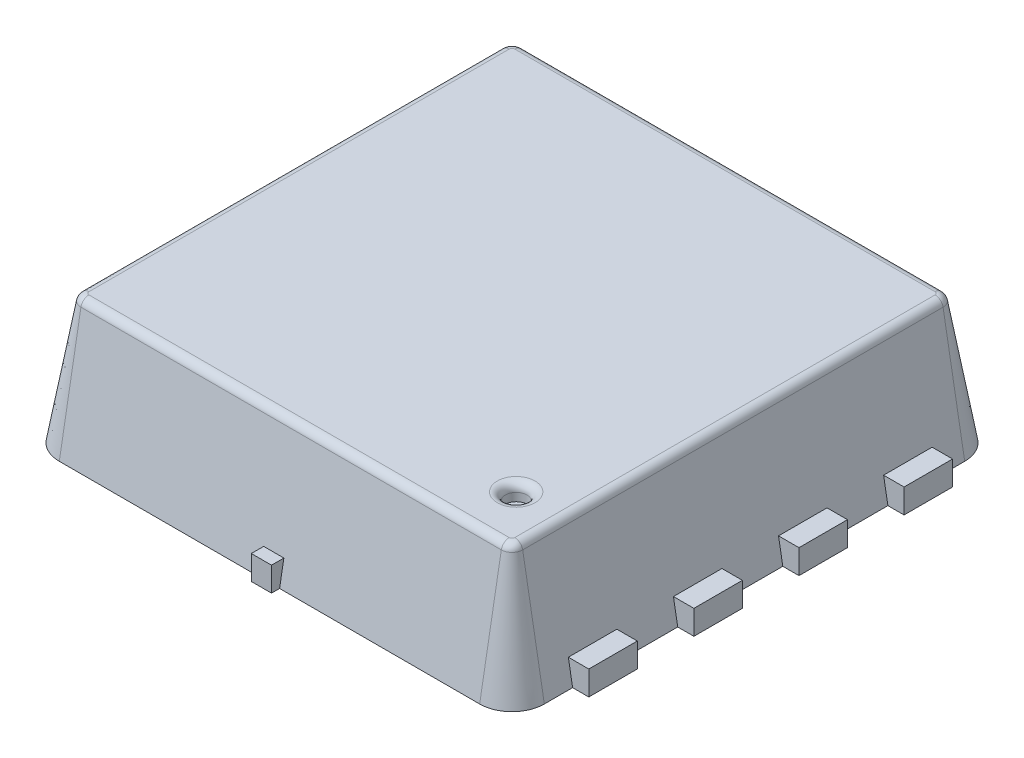
from build123d import *

# Parameters (mm, degrees)
SKETCH1_W               = 3
SKETCH1_H               = 3
BOSS_EXTRUDE1_DEPTH     = 0.8
FILLET1_R               = 0.2
CHAMFER1_SIZE           = 0.8
CHAMFER1_SIZE_2         = 0.141061585
SKETCH2_W               = 0.2
SKETCH2_H               = 0.3
BOSS_EXTRUDE2_DEPTH     = 0.15
LPATTERN1_COUNT         = 4
LPATTERN1_PITCH         = 0.65
MIRROR2_COPY_1_SKETCH_W = 0.2
MIRROR2_COPY_1_SKETCH_H = 0.3
MIRROR2_COPY_1_DEPTH    = 0.15
MIRROR2_COPY_2_SKETCH_W = 0.2
MIRROR2_COPY_2_SKETCH_H = 0.3
MIRROR2_COPY_2_DEPTH    = 0.15
MIRROR2_COPY_3_SKETCH_W = 0.2
MIRROR2_COPY_3_SKETCH_H = 0.3
MIRROR2_COPY_3_DEPTH    = 0.15
SKETCH3_R               = 0.066703592
CUT_EXTRUDE1_DEPTH      = 0.1
SKETCH4_W               = 0.125
SKETCH4_H               = 0.1
BOSS_EXTRUDE3_DEPTH     = 0.15
FILLET2_R               = 0.05


with BuildPart() as part:
    # Sketch1 → Boss-Extrude1 (new body)
    with BuildSketch(Plane(origin=(0, 0, 0), x_dir=(1, 0, 0), z_dir=(0, 1, 0))):
        Rectangle(SKETCH1_W, SKETCH1_H)
    extrude(amount=BOSS_EXTRUDE1_DEPTH)

    # Fillet1
    fillet1_edges = [part.edges().sort_by_distance(p)[0] for p in [
        (1.5, 0.4, 1.5),
        (-1.5, 0.4, 1.5),
        (-1.5, 0.4, -1.5),
        (1.5, 0.4, -1.5),
    ]]
    fillet(fillet1_edges, radius=FILLET1_R)

    # Chamfer1
    # the kernel refuses this chamfer: 0.8, 0.141061585 mm, written as the material it takes off along each edge
    with BuildSketch(Plane(origin=(-1.3, 0.8, 1.5), x_dir=(0, -0.9999776716360547, 0.006682531656101619), z_dir=(1, 0, 0))) as chamfer1_piece_1:
        Polygon((CHAMFER1_SIZE * 0.999977671636, CHAMFER1_SIZE * 0.0066825316561), (-CHAMFER1_SIZE_2 * 0.00668253163558, CHAMFER1_SIZE_2 * 0.999977668565), (0, 0), align=None)
    extrude(amount=2.6, mode=Mode.SUBTRACT)
    with BuildSketch(Plane(origin=(-1.5, 0.8, -1.3), x_dir=(0.9776715712462587, 0.2101387607674316, 0), z_dir=(0, 0, 1)), Plane(origin=(1.3, 0.8, -1.5), x_dir=(0, 0.2101387607674316, 0.9776715712462587), z_dir=(-1, 0, 0)), Plane(origin=(1.5, 0.8, 1.3), x_dir=(-0.9776715712462587, 0.2101387607674316, 0), z_dir=(0, 0, -1))) as chamfer1_piece_2:
        Polygon((CHAMFER1_SIZE_2 * 0.977671568244, -CHAMFER1_SIZE_2 * 0.210138760122), (-CHAMFER1_SIZE * 0.210138760767, -CHAMFER1_SIZE * 0.977671571246), (0, 0), align=None)
    extrude(amount=2.6, mode=Mode.SUBTRACT)
    with BuildSketch(Plane(origin=(1.3, 0.8, -1.3), x_dir=(1, 0, 0), z_dir=(0, 0, 1))) as chamfer1_piece_3:
        Polygon((0.2 - CHAMFER1_SIZE_2 * 0.999999996929, 0), (0.2, -CHAMFER1_SIZE), (0.2, 0), align=None)
    revolve(axis=Axis((1.3, 0.8, -1.3), (0, 1, 0)), revolution_arc=90, mode=Mode.SUBTRACT)
    with BuildSketch(Plane(origin=(1.3, 0.8, 1.3), x_dir=(0, 0, 1), z_dir=(-1, 0, 0))) as chamfer1_piece_4:
        Polygon((0.2, -CHAMFER1_SIZE), (0.2 - CHAMFER1_SIZE_2 * 0.999999996929, 0), (0.2, 0), align=None)
    revolve(axis=Axis((1.3, 0.8, 1.3), (0, 1, 0)), revolution_arc=90, mode=Mode.SUBTRACT)
    with BuildSketch(Plane(origin=(-1.3, 0.8, 1.3), x_dir=(0, 0, 1), z_dir=(1, 0, 0))) as chamfer1_piece_5:
        Polygon((0.2, CHAMFER1_SIZE), (0.2 - CHAMFER1_SIZE_2 * 0.999999996929, 0), (0.2, 0), align=None)
    revolve(axis=Axis((-1.3, 0.8, 1.3), (0, -1, 0)), revolution_arc=90, mode=Mode.SUBTRACT)
    with BuildSketch(Plane(origin=(-1.3, 0.8, -1.3), x_dir=(0, 0, -1), z_dir=(1, 0, 0))) as chamfer1_piece_6:
        Polygon((0.2 - CHAMFER1_SIZE_2 * 0.999999996929, 0), (0.2, -CHAMFER1_SIZE), (0.2, 0), align=None)
    revolve(axis=Axis((-1.3, 0.8, -1.3), (0, 1, 0)), revolution_arc=90, mode=Mode.SUBTRACT)


with BuildPart() as body_2:
    # Sketch2 → Boss-Extrude2 (new body)
    with BuildSketch(Plane.XZ):
        with Locations((-1.5, -0.975)):
            Rectangle(SKETCH2_W, SKETCH2_H)
    boss_extrude2 = extrude(amount=-BOSS_EXTRUDE2_DEPTH)


with BuildPart() as lpattern1_1:
    # LPattern1: Boss-Extrude2 ×4
    with Locations(*[(0, 0, i * LPATTERN1_PITCH) for i in range(1, LPATTERN1_COUNT)]):
        add(boss_extrude2)


with BuildPart() as part_1:
    add(part.part)

    # Mirror2: Boss-Extrude2 across plane
    add(boss_extrude2.mirror(Plane.ZY))

    # Mirror2 copy 1 sketch → Mirror2 copy 1 (add)
    with BuildSketch(Plane(origin=(0, 0, 0.65), x_dir=(-1, 0, 0), z_dir=(0, -1, 0))):
        with Locations((-1.5, 0.975)):
            Rectangle(MIRROR2_COPY_1_SKETCH_W, MIRROR2_COPY_1_SKETCH_H)
    extrude(amount=-MIRROR2_COPY_1_DEPTH)

    # Mirror2 copy 2 sketch → Mirror2 copy 2 (add)
    with BuildSketch(Plane(origin=(0, 0, 1.3), x_dir=(-1, 0, 0), z_dir=(0, -1, 0))):
        with Locations((-1.5, 0.975)):
            Rectangle(MIRROR2_COPY_2_SKETCH_W, MIRROR2_COPY_2_SKETCH_H)
    extrude(amount=-MIRROR2_COPY_2_DEPTH)

    # Mirror2 copy 3 sketch → Mirror2 copy 3 (add)
    with BuildSketch(Plane(origin=(0, 0, 1.95), x_dir=(-1, 0, 0), z_dir=(0, -1, 0))):
        with Locations((-1.5, 0.975)):
            Rectangle(MIRROR2_COPY_3_SKETCH_W, MIRROR2_COPY_3_SKETCH_H)
    extrude(amount=-MIRROR2_COPY_3_DEPTH)

    # Sketch3 → Cut-Extrude1 (cut)
    with BuildSketch(Plane(origin=(0, 0.8, 0), x_dir=(1, 0, 0), z_dir=(0, 1, 0))):
        with Locations(Location((1.07649938, -1.050640543, 0), (0, 0, 270))):
            Circle(SKETCH3_R)
    extrude(amount=-CUT_EXTRUDE1_DEPTH, mode=Mode.SUBTRACT)

    # Fillet2
    fillet2_edges = [part_1.edges().sort_by_distance(p)[0] for p in [
        (1.07649938, 0.8, 0.983936951),
        (0, 0.8, -1.358938415),
        (-1.341675753, 0.8, -1.341675753),
        (-1.358938415, 0.8, 0),
        (-1.341675753, 0.8, 1.341675753),
        (0, 0.8, 1.358938415),
        (1.341675753, 0.8, 1.341675753),
        (1.358938415, 0.8, 0),
        (1.341675753, 0.8, -1.341675753),
    ]]
    fillet(fillet2_edges, radius=FILLET2_R)


with BuildPart() as body_6:
    # Sketch4 → Boss-Extrude3 (new body)
    with BuildSketch(Plane.XZ):
        with Locations((0, -1.5)):
            Rectangle(SKETCH4_W, SKETCH4_H)
    extrude(amount=-BOSS_EXTRUDE3_DEPTH)


with BuildPart() as body_7:
    # Mirror7: mirrored copy
    add(body_6.part.mirror(Plane.XY))


solid = Compound([body_2.part, lpattern1_1.part, part_1.part, body_6.part, body_7.part])
